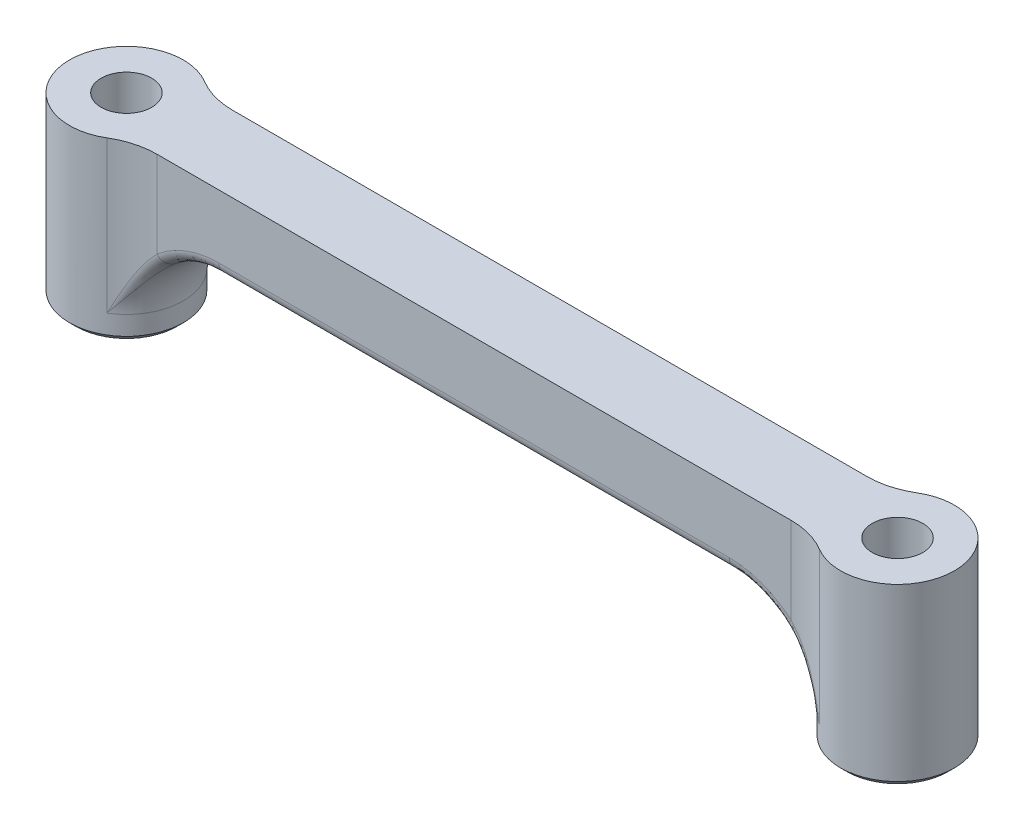
from build123d import *

# Parameters (mm, degrees)
SKETCH1_R           = 1.0000000000000016
BOSS_EXTRUDE1_DEPTH = 3
BOSS_EXTRUDE2_START = -4
SKETCH1_3_R         = 2.2500000000000018
SKETCH1_3_R_2       = 1.0000000000000016
BOSS_EXTRUDE2_DEPTH = 4
FILLET1_R           = 3
FILLET2_R           = 0.5
CHAMFER1_SIZE       = 0.25


with BuildPart() as part:
    # Sketch1 → Boss-Extrude1 (new body)
    with BuildSketch(Plane(origin=(0, 0, 0), x_dir=(1, 0, 0), z_dir=(0, 1, 0))):
        with BuildLine():
            Line((0, 1.5), (-13.562949016875159, 1.5))
            ThreePointArc((-13.562949016875157, 1.500000000000001), (-17.490000000000002, 2.8e-16), (-13.562949016875159, -1.5000000000000013))
            Line((-13.562949016875159, -1.5), (0, -1.5))
            Line((3.8e-16, -1.5), (3.8e-16, 1.5))
        make_face()
        with Locations((-15.24, 0)):
            Circle(SKETCH1_R, mode=Mode.SUBTRACT)
    extrude(amount=BOSS_EXTRUDE1_DEPTH)

    # Sketch1<3> → Boss-Extrude2 (add)
    with BuildSketch(Plane(origin=(0, 0, 0), x_dir=(1, 0, 0), z_dir=(0, 1, 0)).offset(BOSS_EXTRUDE2_START)):
        with Locations((-15.240000000000002, -4.4e-16)):
            Circle(SKETCH1_3_R)
        with Locations((-15.24, 0)):
            Circle(SKETCH1_3_R_2, mode=Mode.SUBTRACT)
    extrude(amount=BOSS_EXTRUDE2_DEPTH)

    # Fillet1
    fillet1_edges = [part.edges().sort_by_distance(p)[0] for p in [
        (-13.13811219233389, 0, 0.8028497019894542),
        (-13.562949016875159, 1.5, -1.5),
        (-13.562949016875159, 1.5, 1.5000000000000009),
    ]]
    fillet(fillet1_edges, radius=FILLET1_R)

    # Mirror1: part across plane


with BuildPart() as part_1:
    add(part.part)
    add(part.part.mirror(Plane(origin=(0, 3, 0), x_dir=(0, 0, 1), z_dir=(1, 0, 0))))

    # Fillet2
    fillet2_edges = [part_1.edges().sort_by_distance(p)[0] for p in [
        (-13.399651720133953, -1.9063269188588854, -1.6270531940039705),
        (-11.456820517645129, -0.24194113741398782, -1.5),
        (13.399651720133953, -1.9063269188588854, -1.6270531940039705),
        (11.456820517645129, -0.24194113741398782, -1.5),
        (-13.399651715432794, -1.9063269122540492, 1.6270531925904639),
        (-11.456820517675501, -0.24194113738750933, 1.5),
        (13.399651715432794, -1.9063269122540492, 1.6270531925904639),
        (11.456820517675501, -0.24194113738750933, 1.5),
        (0, 0, -1.4999999999999993),
        (0, 0, 1.4999999999999987),
    ]]
    fillet(fillet2_edges, radius=FILLET2_R)

    # Chamfer1
    chamfer1_edges = [part_1.edges().sort_by_distance(p)[0] for p in [
        (-17.490000000000002, -4, 1.7e-16),
        (17.490000000000002, -4, 1.7e-16),
    ]]
    chamfer(chamfer1_edges, length=CHAMFER1_SIZE)


solid = part_1.part
